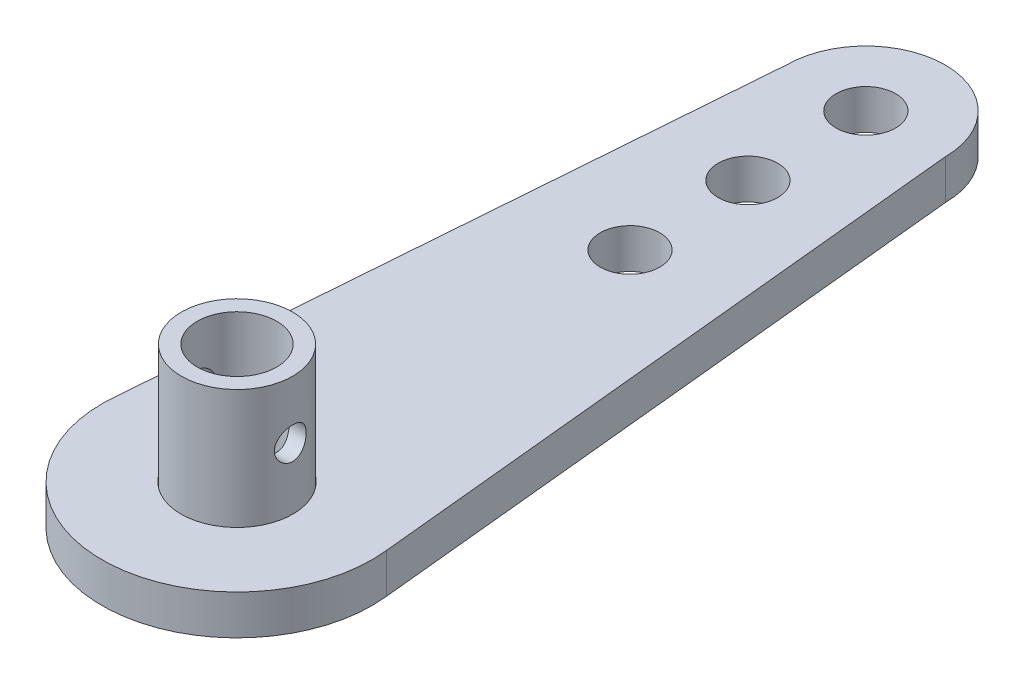
from build123d import *

# Parameters (mm, degrees)
SKETCH1_R                = 14.1
SKETCH1_R_2              = 7.5
BASE_FLANGE1_DEPTH       = 10
BOSS_EXTRUDE1_DEPTH      = 30
BOSS_EXTRUDE1_DEPTH_BACK = 10
SKETCH6_R                = 14
SKETCH6_R_2              = 10
CUT_EXTRUDE1_DEPTH       = 186.614422829
CUT_EXTRUDE1_DEPTH_BACK  = 186.614422829
SKETCH8_R                = 4


# Sheet-metal steps are written as plain solids
with BuildPart() as part:
    # Sketch1 → Base-Flange1 (new body)
    with BuildSketch(Plane(origin=(0, 0, 0), x_dir=(1, 0, 0), z_dir=(0, 1, 0))):
        with BuildLine():
            Line((-21.709067953, 159.990871886), (-33.787508059, 3.795299618))
            ThreePointArc((-33.787508059, 3.795299618), (0, -34), (33.787508059, 3.795299618))
            Line((33.787508059, 3.795299618), (18.290932047, 159.990871886))
            ThreePointArc((18.290932047, 159.990871886), (-1.709067953, 179.990871886), (-21.709067953, 159.990871886))
        make_face()
        with Locations(Location((0, 0, 0), (0, 0, 270))):
            Circle(SKETCH1_R, mode=Mode.SUBTRACT)
        with Locations(Location((-1.709067953, 159.990871886, 0), (0, 0, 270))):
            Circle(SKETCH1_R_2, mode=Mode.SUBTRACT)
        with Locations(Location((-1.388617712, 129.992583407, 0), (0, 0, 270))):
            Circle(SKETCH1_R_2, mode=Mode.SUBTRACT)
        with Locations(Location((-1.068167471, 99.994294929, 0), (0, 0, 270))):
            Circle(SKETCH1_R_2, mode=Mode.SUBTRACT)
    extrude(amount=-BASE_FLANGE1_DEPTH)


with BuildPart() as body_2:
    # Sketch6 → Boss-Extrude1 (new, two sides: drawn at the far end of the back side and taken through both)
    with BuildSketch(Plane(origin=(0, 0, 0), x_dir=(1, 0, 0), z_dir=(0, 1, 0)).offset(-BOSS_EXTRUDE1_DEPTH_BACK)):
        with Locations(Location((0, 0, 0), (0, 0, 270))):
            Circle(SKETCH6_R)
        with Locations(Location((0, 0, 0), (0, 0, 270))):
            Circle(SKETCH6_R_2, mode=Mode.SUBTRACT)
    extrude(amount=BOSS_EXTRUDE1_DEPTH + BOSS_EXTRUDE1_DEPTH_BACK)

    # Sketch8 → Cut-Extrude1 (cut, two sides: drawn at the far end of the back side and taken through both)
    with BuildSketch(Plane(origin=(0, 0, 0), x_dir=(0, 0, -1), z_dir=(1, 0, 0)).offset(-CUT_EXTRUDE1_DEPTH_BACK)):
        with Locations((0, 15.4)):
            Circle(SKETCH8_R)
    extrude(amount=CUT_EXTRUDE1_DEPTH + CUT_EXTRUDE1_DEPTH_BACK, mode=Mode.SUBTRACT)


solid = Compound([part.part, body_2.part])
